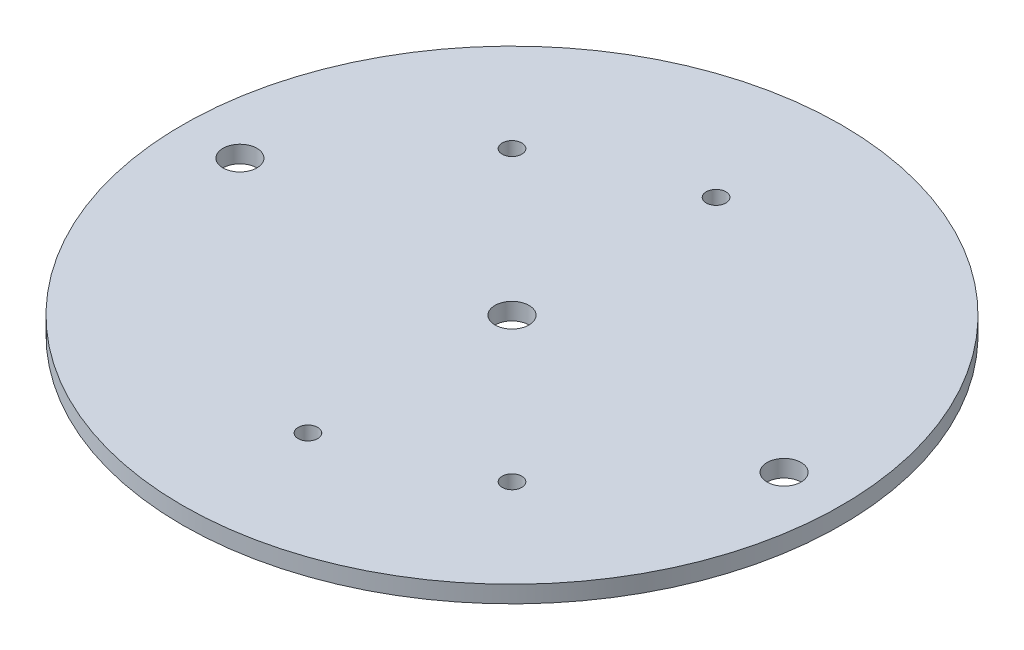
from build123d import *

# Parameters (mm, degrees)
SKETCH2_R           = 61.5315
SKETCH2_R_2         = 3.175
SKETCH2_R_3         = 1.8288
BOSS_EXTRUDE1_DEPTH = 3.175


with BuildPart() as part:
    # Sketch2 → Boss-Extrude1 (new body)
    with BuildSketch(Plane(origin=(0, 0, 0), x_dir=(1, 0, 0), z_dir=(0, 1, 0))):
        Circle(SKETCH2_R)
        with Locations((-50.8, 0)):
            Circle(SKETCH2_R_2, mode=Mode.SUBTRACT)
        with Locations((50.8, 0)):
            Circle(SKETCH2_R_2, mode=Mode.SUBTRACT)
        Circle(SKETCH2_R_2, mode=Mode.SUBTRACT)
        with Locations((0, 38.1)):
            Circle(SKETCH2_R_3, mode=Mode.SUBTRACT)
        with Locations((0, -38.1)):
            Circle(SKETCH2_R_3, mode=Mode.SUBTRACT)
        with Locations((-26.940768363, 26.940768363)):
            Circle(SKETCH2_R_3, mode=Mode.SUBTRACT)
        with Locations((26.940768363, -26.940768363)):
            Circle(SKETCH2_R_3, mode=Mode.SUBTRACT)
    extrude(amount=BOSS_EXTRUDE1_DEPTH)


solid = part.part
